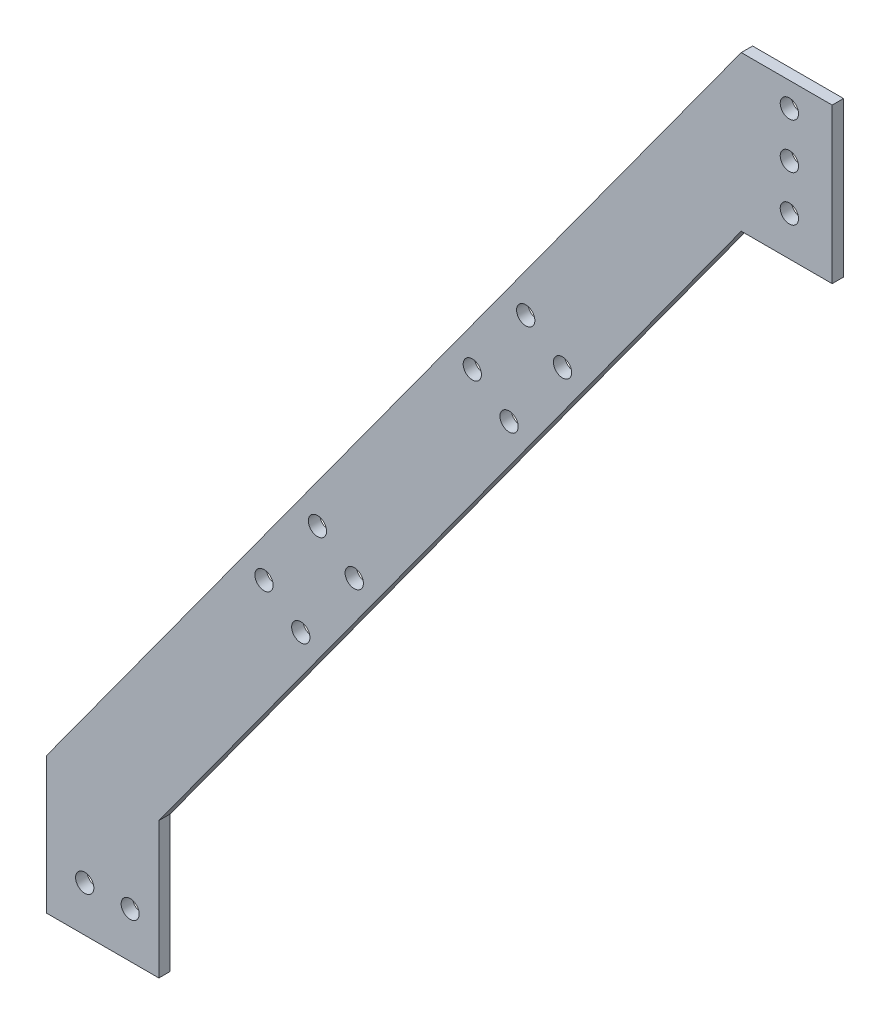
from build123d import *

# Parameters (mm, degrees)
BOSS_EXTRUDE1_DEPTH = 3.175
SKETCH2_R           = 2.5527
SKETCH2_R_2         = 2.522358926
CUT_EXTRUDE1_DEPTH  = 376.971229288
SKETCH3_R           = 2.5527
CUT_EXTRUDE2_DEPTH  = 376.971229288


with BuildPart() as part:
    # Sketch1 → Boss-Extrude1 (new body)
    with BuildSketch(Plane.XY):
        Polygon((0, 0), (0, 38.1), (194.086690307, 305.237411543), (219.486690307, 305.237411543), (219.486690307, 262.024350478), (194.086690307, 262.024350478), (31.396126628, 38.1), (31.396126628, 0), align=None)
    extrude(amount=BOSS_EXTRUDE1_DEPTH)

    # Sketch2 → Cut-Extrude1 (cut, through all)
    with BuildSketch(Plane.XY.offset(3.175)):
        with Locations((207.530063471, 298.426709645)):
            Circle(SKETCH2_R)
        with Locations((207.530063471, 285.726709645)):
            Circle(SKETCH2_R)
        with Locations((23.380063476, 12.7)):
            Circle(SKETCH2_R_2)
        with Locations((10.680063476, 12.7)):
            Circle(SKETCH2_R)
        with Locations((207.530063471, 273.026709645)):
            Circle(SKETCH2_R)
    extrude(amount=-CUT_EXTRUDE1_DEPTH, mode=Mode.SUBTRACT)

    # Sketch3 → Cut-Extrude2 (cut, through all)
    with BuildSketch(Plane.XY.offset(3.175)):
        with Locations((118.955934931, 191.025532906)):
            Circle(SKETCH3_R)
        with Locations((144.160196168, 204.109691859)):
            Circle(SKETCH3_R)
        with Locations((133.885680339, 211.574564563)):
            Circle(SKETCH3_R)
        with Locations((129.23045076, 183.560660202)):
            Circle(SKETCH3_R)
        with Locations((60.77358911, 110.944404028)):
            Circle(SKETCH3_R)
        with Locations((75.703334519, 131.493435685)):
            Circle(SKETCH3_R)
        with Locations((85.977850347, 124.028562981)):
            Circle(SKETCH3_R)
        with Locations((71.048104939, 103.479531323)):
            Circle(SKETCH3_R)
    extrude(amount=-CUT_EXTRUDE2_DEPTH, mode=Mode.SUBTRACT)


solid = part.part
